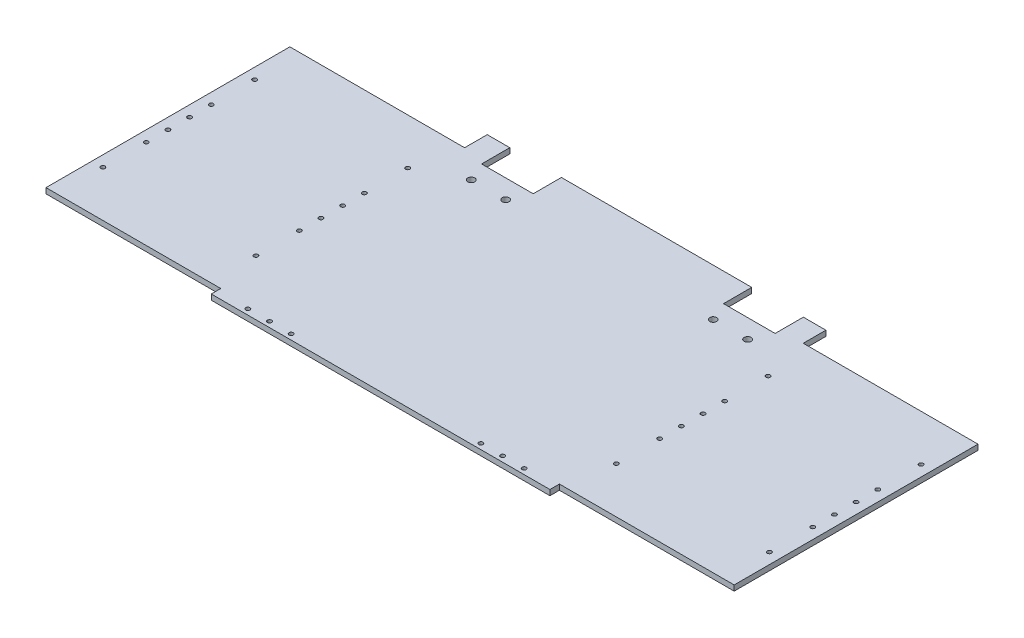
from build123d import *

# Parameters (mm, degrees)
SKETCH1_R           = 2.564
SKETCH1_R_2         = 1.55
BOSS_EXTRUDE1_DEPTH = 4


with BuildPart() as part:
    # Sketch1 → Boss-Extrude1 (new body)
    with BuildSketch(Plane(origin=(0, 0, 0), x_dir=(1, 0, 0), z_dir=(0, 1, 0))):
        Polygon((129, 0), (129, -7), (379, -7), (379, 0), (508, 0), (508, 180), (379, 180), (379, 196.718), (362.35, 196.718), (362.35, 175.89), (324.25, 175.89), (324.25, 196.718), (183.75, 196.718), (183.75, 175.89), (145.65, 175.89), (145.65, 196.718), (129, 196.718), (129, 180), (0, 180), (0, 0), align=None)
        with Locations((152, 161.92)):
            Circle(SKETCH1_R, mode=Mode.SUBTRACT)
        with Locations((177.4, 161.92)):
            Circle(SKETCH1_R, mode=Mode.SUBTRACT)
        with Locations((152, -3)):
            Circle(SKETCH1_R_2, mode=Mode.SUBTRACT)
        with Locations((184, -3)):
            Circle(SKETCH1_R_2, mode=Mode.SUBTRACT)
        with Locations((330.6, 161.92)):
            Circle(SKETCH1_R, mode=Mode.SUBTRACT)
        with Locations((356, 161.92)):
            Circle(SKETCH1_R, mode=Mode.SUBTRACT)
        with Locations((168, -3)):
            Circle(SKETCH1_R_2, mode=Mode.SUBTRACT)
        with Locations((324, -3)):
            Circle(SKETCH1_R_2, mode=Mode.SUBTRACT)
        with Locations((340, -3)):
            Circle(SKETCH1_R_2, mode=Mode.SUBTRACT)
        with Locations((356, -3)):
            Circle(SKETCH1_R_2, mode=Mode.SUBTRACT)
        with Locations((121, 146)):
            Circle(SKETCH1_R_2, mode=Mode.SUBTRACT)
        with Locations((121, 114)):
            Circle(SKETCH1_R_2, mode=Mode.SUBTRACT)
        with Locations((121, 98)):
            Circle(SKETCH1_R_2, mode=Mode.SUBTRACT)
        with Locations((121, 82)):
            Circle(SKETCH1_R_2, mode=Mode.SUBTRACT)
        with Locations((121, 66)):
            Circle(SKETCH1_R_2, mode=Mode.SUBTRACT)
        with Locations((121, 34)):
            Circle(SKETCH1_R_2, mode=Mode.SUBTRACT)
        with Locations((387, 146)):
            Circle(SKETCH1_R_2, mode=Mode.SUBTRACT)
        with Locations((387, 114)):
            Circle(SKETCH1_R_2, mode=Mode.SUBTRACT)
        with Locations((387, 98)):
            Circle(SKETCH1_R_2, mode=Mode.SUBTRACT)
        with Locations((387, 82)):
            Circle(SKETCH1_R_2, mode=Mode.SUBTRACT)
        with Locations((387, 66)):
            Circle(SKETCH1_R_2, mode=Mode.SUBTRACT)
        with Locations((387, 34)):
            Circle(SKETCH1_R_2, mode=Mode.SUBTRACT)
        with Locations((8, 146)):
            Circle(SKETCH1_R_2, mode=Mode.SUBTRACT)
        with Locations((8, 114)):
            Circle(SKETCH1_R_2, mode=Mode.SUBTRACT)
        with Locations((8, 98)):
            Circle(SKETCH1_R_2, mode=Mode.SUBTRACT)
        with Locations((8, 82)):
            Circle(SKETCH1_R_2, mode=Mode.SUBTRACT)
        with Locations((8, 66)):
            Circle(SKETCH1_R_2, mode=Mode.SUBTRACT)
        with Locations((8, 34)):
            Circle(SKETCH1_R_2, mode=Mode.SUBTRACT)
        with Locations((500, 34)):
            Circle(SKETCH1_R_2, mode=Mode.SUBTRACT)
        with Locations((500, 66)):
            Circle(SKETCH1_R_2, mode=Mode.SUBTRACT)
        with Locations((500, 82)):
            Circle(SKETCH1_R_2, mode=Mode.SUBTRACT)
        with Locations((500, 98)):
            Circle(SKETCH1_R_2, mode=Mode.SUBTRACT)
        with Locations((500, 114)):
            Circle(SKETCH1_R_2, mode=Mode.SUBTRACT)
        with Locations((500, 146)):
            Circle(SKETCH1_R_2, mode=Mode.SUBTRACT)
    extrude(amount=BOSS_EXTRUDE1_DEPTH)


solid = part.part
